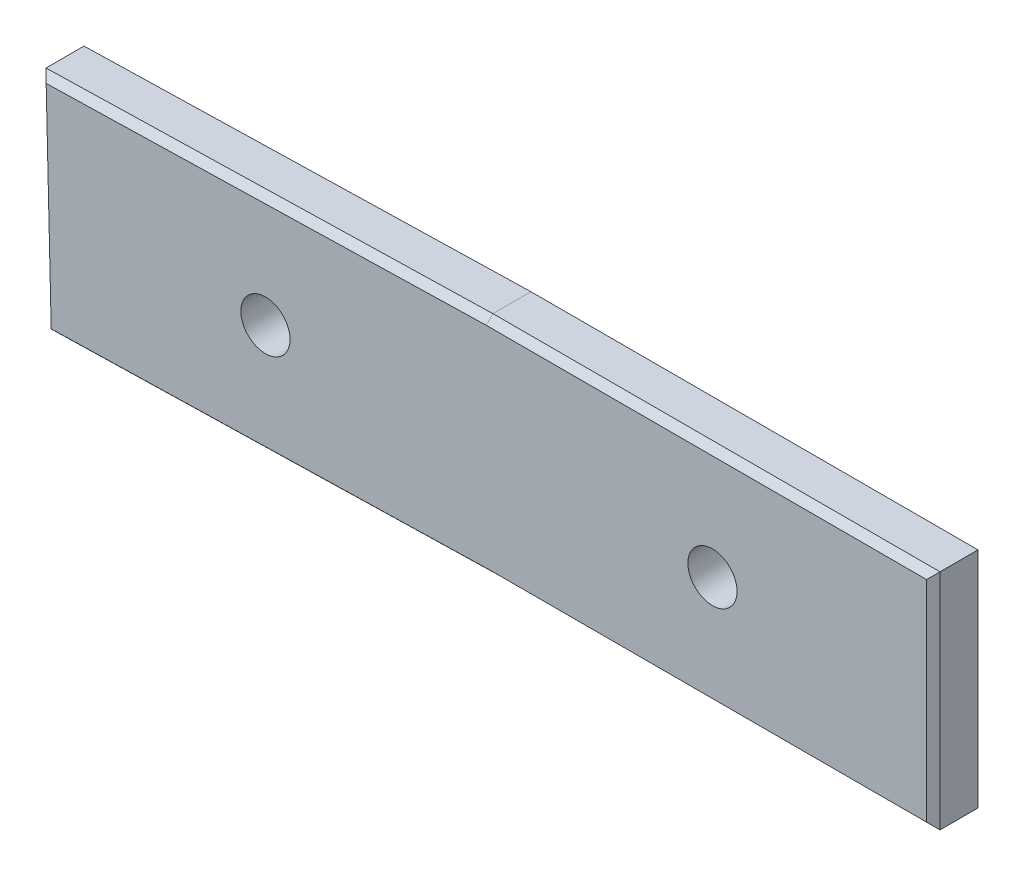
from build123d import *

# Parameters (mm, degrees)
SKETCH3_R           = 2.2
BOSS_EXTRUDE1_DEPTH = 4
CHAMFER1_SIZE       = 0.6


with BuildPart() as part:
    # Sketch3 → Boss-Extrude1 (new body)
    with BuildSketch(Plane.XY):
        Polygon((-39.988460604, 11.048492995), (-40.468829865, 31.042723297), (-0.480369261, 32.003461819), (39.51963059, 32), (39.51963059, 12), (0, 12), align=None)
        with Locations((19.759815295, 22)):
            Circle(SKETCH3_R, mode=Mode.SUBTRACT)
        with Locations((-20.234414932, 21.525977407)):
            Circle(SKETCH3_R, mode=Mode.SUBTRACT)
    extrude(amount=BOSS_EXTRUDE1_DEPTH)

    # Chamfer1
    # the kernel refuses this chamfer: 0.6 mm, written as the material it takes off along each edge
    with BuildSketch(Plane(origin=(39.51963059, 33.543009793, 4), x_dir=(0, 0, -1), z_dir=(0, -1, 0)), Plane(origin=(-39.951399881, 9.505928338, 4), x_dir=(0, 0, -1), z_dir=(-0.024018463033284497, 0.9997115151049921, 0))) as chamfer1_piece_1:
        Polygon((CHAMFER1_SIZE, 0), (0, -CHAMFER1_SIZE), (0, 0), align=None)
    extrude(amount=23.086019586, mode=Mode.SUBTRACT)
    with BuildSketch(Plane(origin=(-2.023379048, 32.003595359, 4), x_dir=(0, 0, -1), z_dir=(0.999999996254941, -8.654546850213052e-05, 0)), Plane(origin=(-42.011394523, 31.005662574, 4), x_dir=(0, 0, -1), z_dir=(0.9997115151049922, 0.02401846303328057, 0))) as chamfer1_piece_2:
        Polygon((CHAMFER1_SIZE, 0), (0, -CHAMFER1_SIZE), (0, 0), align=None)
    extrude(amount=43.086019586, mode=Mode.SUBTRACT)
    with BuildSketch(Plane(origin=(1.542573167, 12.036704818, 4), x_dir=(0, 0, -1), z_dir=(-0.9997170300986874, -0.023787806344009378, 0))) as chamfer1_piece_3_section:
        Polygon((CHAMFER1_SIZE, 0), (0, -CHAMFER1_SIZE), (0, 0), align=None)
    chamfer1_piece_3 = extrude(amount=43.085798923, mode=Mode.PRIVATE)
    chamfer1_piece_3 = split(chamfer1_piece_3, bisect_by=Plane(origin=(1.542573167, 12.318352409, 3.718352409), z_dir=(0, -0.7071067811865478, 0.7071067811865474)), keep=Keep.TOP, mode=Mode.PRIVATE)
    add(chamfer1_piece_3, mode=Mode.SUBTRACT)
    with BuildSketch(Plane(origin=(41.062640382, 12, 4), x_dir=(0, 0, -1), z_dir=(-1, 0, 0))) as chamfer1_piece_4_section:
        Polygon((CHAMFER1_SIZE, 0), (0, -CHAMFER1_SIZE), (0, 0), align=None)
    chamfer1_piece_4 = extrude(amount=42.605650175, mode=Mode.PRIVATE)
    chamfer1_piece_4 = split(chamfer1_piece_4, bisect_by=Plane(origin=(41.043886193, 12.788171977, 3.211604931), z_dir=(0.01682051917540141, -0.706906691250458, 0.7071067811865475)), keep=Keep.TOP, mode=Mode.PRIVATE)
    add(chamfer1_piece_4, mode=Mode.SUBTRACT)


solid = part.part
